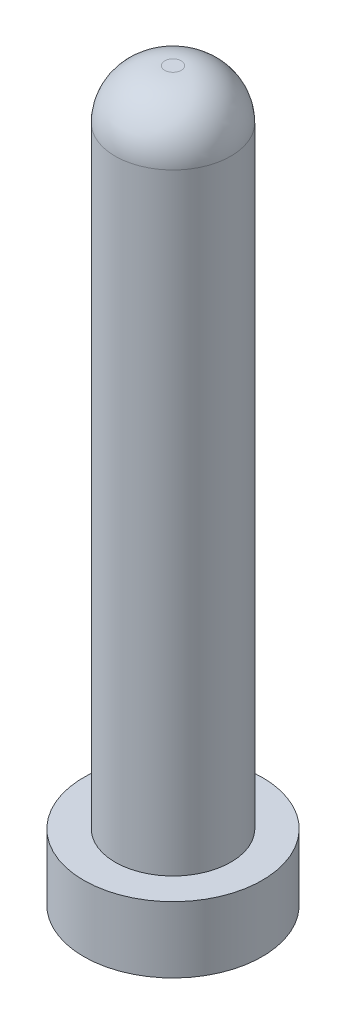
from build123d import *

# Parameters (mm, degrees)
SKETCH1_R           = 2.7
BOSS_EXTRUDE1_DEPTH = 2
SKETCH3_R           = 0.95
CUT_EXTRUDE2_DEPTH  = 9.5
SKETCH7_R           = 1.2
CUT_EXTRUDE4_DEPTH  = 2.8
SKETCH2_R           = 1.75
BOSS_EXTRUDE2_DEPTH = 20
FILLET2_R           = 1.5
SKETCH8_R           = 0.95
CUT_EXTRUDE5_DEPTH  = 9.5


with BuildPart() as part:
    # Sketch1 → Boss-Extrude1 (new body)
    with BuildSketch(Plane(origin=(0, 0, 0), x_dir=(1, 0, 0), z_dir=(0, 1, 0))):
        Circle(SKETCH1_R)
    extrude(amount=BOSS_EXTRUDE1_DEPTH)

    # Sketch3 → Cut-Extrude2 (cut)
    with BuildSketch(Plane.XZ):
        Circle(SKETCH3_R)
    extrude(amount=-CUT_EXTRUDE2_DEPTH, mode=Mode.SUBTRACT)

    # Sketch7 → Cut-Extrude4 (cut)
    with BuildSketch(Plane.XZ):
        Circle(SKETCH7_R)
    extrude(amount=-CUT_EXTRUDE4_DEPTH, mode=Mode.SUBTRACT)

    # Sketch2 → Boss-Extrude2 (add)
    with BuildSketch(Plane(origin=(0, 2, 0), x_dir=(1, 0, 0), z_dir=(0, 1, 0))):
        Circle(SKETCH2_R)
    extrude(amount=BOSS_EXTRUDE2_DEPTH)

    # Fillet2
    fillet2_edges = [part.edges().sort_by_distance(p)[0] for p in [
        (-1.75, 22, 0),
    ]]
    fillet(fillet2_edges, radius=FILLET2_R)

    # Sketch8 → Cut-Extrude5 (cut)
    with BuildSketch(Plane.XZ):
        Circle(SKETCH8_R)
    extrude(amount=-CUT_EXTRUDE5_DEPTH, mode=Mode.SUBTRACT)


solid = part.part
